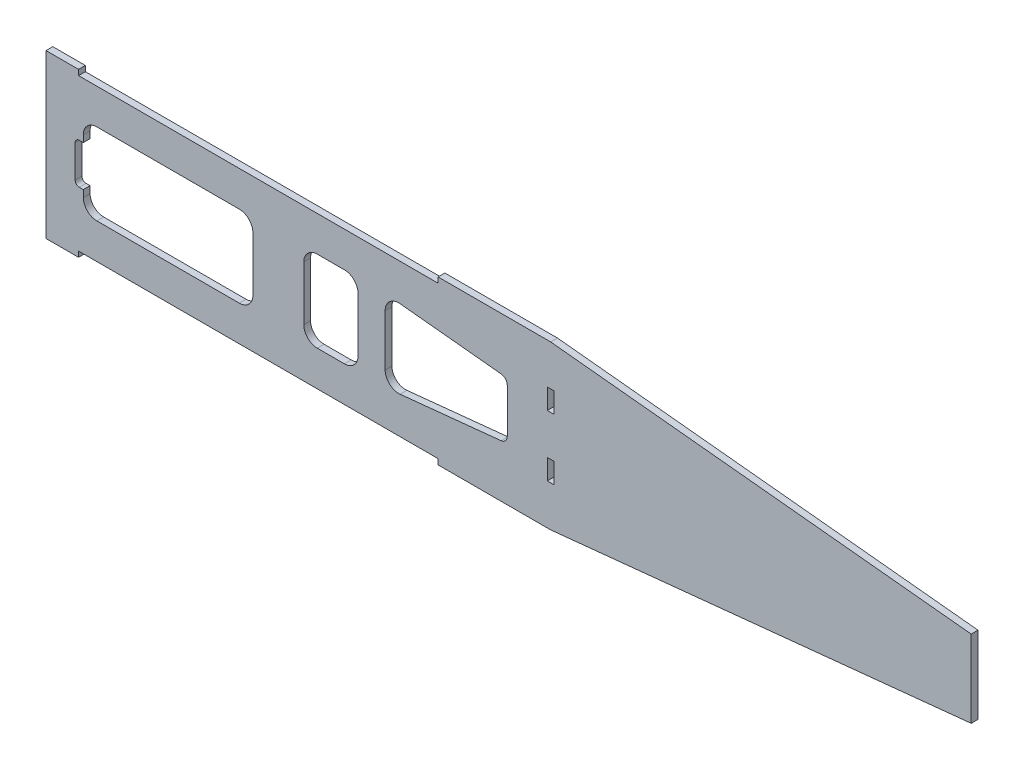
from build123d import *

# Parameters (mm, degrees)
GRUNDPLATTE_DEPTH                  = 5
SCHNITT_LINEAR_AUSTRAGEN1_DEPTH    = 685.652466584
VERRUNDUNG1_R                      = 10
SKIZZE3_W                          = 265
SKIZZE3_H                          = 4
AUSSCHNITT_FL_CHENAUFDOPPLER_DEPTH = 685.652466584
SKIZZE4_W                          = 40
SKIZZE4_H                          = 60
AUSSCHNITT_GEWICHT_DEPTH           = 685.652466584
VERRUNDUNG2_R                      = 10
VERRUNDUNG3_R                      = 5
VERRUNDUNG4_R                      = 3
SKIZZE5_W                          = 5
SKIZZE5_H                          = 15
SCHNITT_LINEAR_AUSTRAGEN2_DEPTH    = 685.652466584


with BuildPart() as part:
    # Skizze1 → Grundplatte (new body)
    with BuildSketch(Plane.XY):
        Polygon((0, 60), (0, -60), (372, -60), (682, -28.5), (682, 28.5), (372, 60), align=None)
    extrude(amount=GRUNDPLATTE_DEPTH)

    # Skizze2 → Schnitt-Linear austragen1 (cut, through all)
    with BuildSketch(Plane.XY.offset(5)):
        Polygon((152.5, 30), (27.5, 30), (27.5, 15), (21.5, 15), (21.5, -15), (27.5, -15), (27.5, -30), (152.5, -30), align=None)
    extrude(amount=-SCHNITT_LINEAR_AUSTRAGEN1_DEPTH, mode=Mode.SUBTRACT)

    # Verrundung1
    verrundung1_edges = [part.edges().sort_by_distance(p)[0] for p in [
        (152.5, 30, 2.5),
        (152.5, -30, 2.5),
        (27.5, 30, 2.5),
        (27.5, -30, 2.5),
    ]]
    fillet(verrundung1_edges, radius=VERRUNDUNG1_R)

    # Skizze3 → Ausschnitt_Flächenaufdoppler (cut, through all)
    with BuildSketch(Plane.XY.offset(5)):
        with Locations((156.5, 58)):
            Rectangle(SKIZZE3_W, SKIZZE3_H)
        with Locations((156.5, -58)):
            Rectangle(SKIZZE3_W, SKIZZE3_H)
    extrude(amount=-AUSSCHNITT_FL_CHENAUFDOPPLER_DEPTH, mode=Mode.SUBTRACT)

    # Skizze4 → Ausschnitt Gewicht (cut, through all)
    with BuildSketch(Plane.XY.offset(5)):
        with Locations((210, 0)):
            Rectangle(SKIZZE4_W, SKIZZE4_H)
        Polygon((250, -30), (250, 30), (340, 20.85483871), (340, -20.85483871), align=None)
    extrude(amount=-AUSSCHNITT_GEWICHT_DEPTH, mode=Mode.SUBTRACT)

    # Verrundung2
    verrundung2_edges = [part.edges().sort_by_distance(p)[0] for p in [
        (250, -30, 2.5),
        (250, 30, 2.5),
        (190, -30, 2.5),
        (230, -30, 2.5),
        (230, 30, 2.5),
        (190, 30, 2.5),
    ]]
    fillet(verrundung2_edges, radius=VERRUNDUNG2_R)

    # Verrundung3
    verrundung3_edges = [part.edges().sort_by_distance(p)[0] for p in [
        (340, -20.85483871, 2.5),
        (340, 20.85483871, 2.5),
    ]]
    fillet(verrundung3_edges, radius=VERRUNDUNG3_R)

    # Verrundung4
    verrundung4_edges = [part.edges().sort_by_distance(p)[0] for p in [
        (21.5, -15, 2.5),
        (21.5, 15, 2.5),
    ]]
    fillet(verrundung4_edges, radius=VERRUNDUNG4_R)

    # Skizze5 → Schnitt-Linear austragen2 (cut, through all)
    with BuildSketch(Plane.XY.offset(5)):
        with Locations((372, 22.5)):
            Rectangle(SKIZZE5_W, SKIZZE5_H)
        with Locations((372, -22.5)):
            Rectangle(SKIZZE5_W, SKIZZE5_H)
    extrude(amount=-SCHNITT_LINEAR_AUSTRAGEN2_DEPTH, mode=Mode.SUBTRACT)


solid = part.part
